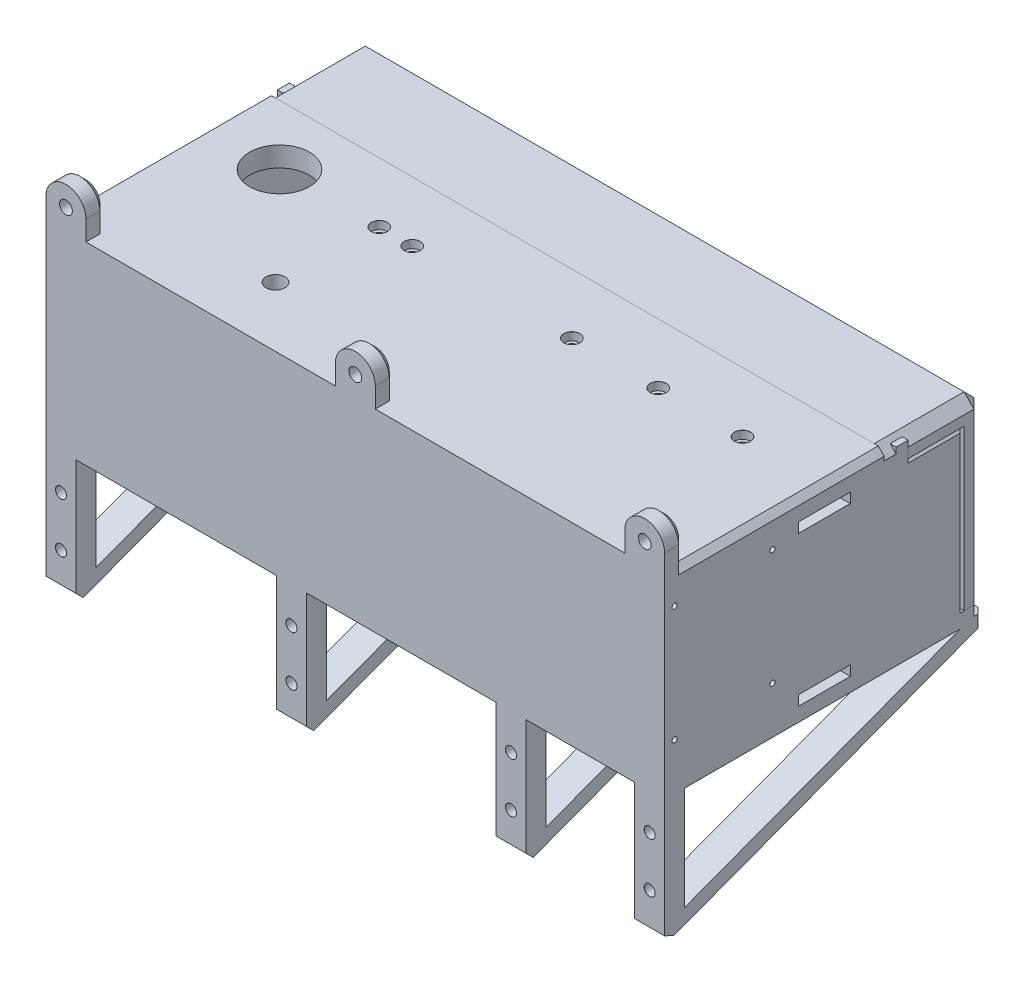
from build123d import *
from OCP.BRepFilletAPI import BRepFilletAPI_MakeChamfer

# Parameters (mm, degrees)
WALLS_DEPTH                   = 310
LID_DEPTH                     = 310
LEG1_DEPTH                    = 15
LEG4_START                    = 310
LEG4_DEPTH                    = 15
LEG2_START                    = 123
LEG2_DEPTH                    = 7.5
LEG3_START                    = 233
LEG3_DEPTH                    = 7.5
LEFTSIDESKETCH_10_W           = 140
LEFTSIDESKETCH_10_H           = 80
LEFTSIDESKETCH_10_R           = 1.2
LEFTSIDESKETCH_10_W_2         = 11
LEFTSIDESKETCH_10_H_2         = 5
RIGHT_WALL_DEPTH              = 10
LEFT_START                    = 310
LEFT_WALL_DEPTH               = 10
TABLESKETCH_W                 = 62.5
TABLESKETCH_H                 = 65
MOTOR_HOLDER_DEPTH            = 30.5
MOTOR_HOLDER2_DEPTH           = 20.5
TABLESKETCH_7_R               = 27.5
TABLESKETCH_7_R_2             = 19.2
BEARING_CUT_DEPTH             = 1.74
TABLESKETCH_14_R              = 19.2
CAROUSEL_HOLE_DEPTH           = 10
BOSS_EXTRUDE10_START          = -25
TABLESKETCH_8_R               = 3
BOSS_EXTRUDE10_DEPTH          = 15
FUNNEL_START                  = -27
TABLESKETCH_9_R               = 30.5
TABLESKETCH_9_R_2             = 24.5
FUNNEL_TOP_DEPTH              = 2
SKETCH5_W                     = 27
SKETCH5_H                     = 30
SKETCH5_W_2                   = 66
SKETCH5_H_2                   = 58
SPEC_MOUTING_DEPTH            = 4
CBORE_FOR_M4_SHCS1_AT_2_COUNT = 2
CBORE_FOR_M4_SHCS1_AT_2_PITCH = 165.5
CBORE_FOR_M4_SHCS1_AT_3_COUNT = 2
CBORE_FOR_M4_SHCS1_AT_3_PITCH = 123.25
CBORE_FOR_M4_SHCS1_AT_4_COUNT = 2
CBORE_FOR_M4_SHCS1_AT_4_PITCH = 80
CBORE_FOR_M4_SHCS1_AT_5_COUNT = 2
CBORE_FOR_M4_SHCS1_AT_5_PITCH = 16.5
M5_CLEARANCE_HOLE1_AT_2_COUNT = 2
M5_CLEARANCE_HOLE1_AT_2_PITCH = 25
M5_CLEARANCE_HOLE1_AT_3_COUNT = 2
M5_CLEARANCE_HOLE1_AT_3_PITCH = 115.5
M5_CLEARANCE_HOLE1_AT_4_COUNT = 2
M5_CLEARANCE_HOLE1_AT_4_PITCH = 118.174658874
M5_CLEARANCE_HOLE1_AT_5_COUNT = 2
M5_CLEARANCE_HOLE1_AT_5_PITCH = 225.5
M5_CLEARANCE_HOLE1_AT_6_COUNT = 2
M5_CLEARANCE_HOLE1_AT_6_PITCH = 226.88157704
M5_CLEARANCE_HOLE1_AT_7_COUNT = 2
M5_CLEARANCE_HOLE1_AT_7_PITCH = 295
M5_CLEARANCE_HOLE1_AT_8_COUNT = 2
M5_CLEARANCE_HOLE1_AT_8_PITCH = 296.057426862
SKETCH20_R                    = 4.7625
SKETCH20_R_2                  = 15
WATER_WIRE_HOLE_DEPTH         = 10
SKETCH23_R                    = 3.2
TOP_LIPS_DEPTH                = 10
LPATTERN1_COUNT               = 3
LPATTERN1_PITCH               = 145
CHAMFER1_SIZE                 = 3
CHAMFER2_SIZE                 = 5
CHAMFER2_SIZE2                = 3.883638066
SKETCH24_R                    = 1.3
RASPBERRY_PI_HOLES_DEPTH      = 10
CHAMFER4_SIZE                 = 2


# Read off the part's stored shape, not the designer's step: Join1
with BuildPart() as part:
    # LeftSideSketch → walls (new body)
    with BuildSketch(Plane(origin=(0, 0, 0), x_dir=(0, 0, -1), z_dir=(1, 0, 0))):
        Polygon((110, 0), (0, 0), (0, -100), (10, -100), (140.063991261, -100), (160, -100), (160, -95), (155, -95), (155, -90), (150, -90), (93, -90), (67, -90), (10, -90), (10, -10), (67, -10), (93, -10), (122, -10), (122, -2), (116, -2), (116, -5), (110, -5), align=None)
    extrude(amount=WALLS_DEPTH)

    # LeftSideSketch<4> → leg1 (add)
    with BuildSketch(Plane(origin=(0, 0, 0), x_dir=(0, 0, -1), z_dir=(1, 0, 0))):
        Polygon((10, -100), (0, -100), (0, -160), (160, -100), (140.063991261, -100), (10, -148.773996723), align=None)
    extrude(amount=LEG1_DEPTH)

    # LeftSideSketch<5> → leg4 (add)
    with BuildSketch(Plane(origin=(0, 0, 0), x_dir=(0, 0, -1), z_dir=(1, 0, 0)).offset(LEG4_START)):
        Polygon((10, -100), (0, -100), (0, -160), (160, -100), (140.063991261, -100), (10, -148.773996723), align=None)
    extrude(amount=-LEG4_DEPTH)

    # LeftSideSketch<7> → leg2 (add, symmetric)
    with BuildSketch(Plane(origin=(0, 0, 0), x_dir=(0, 0, -1), z_dir=(1, 0, 0)).offset(LEG2_START)):
        Polygon((140.063991261, -100), (160, -100), (0, -160), (0, -100), (10, -100), (10, -148.773996723), align=None)
    extrude(amount=LEG2_DEPTH, both=True)

    # LeftSideSketch<9> → leg3 (add, symmetric)
    with BuildSketch(Plane(origin=(0, 0, 0), x_dir=(0, 0, -1), z_dir=(1, 0, 0)).offset(LEG3_START)):
        Polygon((140.063991261, -100), (160, -100), (0, -160), (0, -100), (10, -100), (10, -148.773996723), align=None)
    extrude(amount=LEG3_DEPTH, both=True)

    # LeftSideSketch<10> → right wall (add)
    with BuildSketch(Plane(origin=(0, 0, 0), x_dir=(0, 0, -1), z_dir=(1, 0, 0))):
        with Locations((80, -50)):
            Rectangle(LEFTSIDESKETCH_10_W, LEFTSIDESKETCH_10_H)
        with Locations((15, -43)):
            Circle(LEFTSIDESKETCH_10_R, mode=Mode.SUBTRACT)
        with Locations((43, -43)):
            Circle(LEFTSIDESKETCH_10_R, mode=Mode.SUBTRACT)
        with Locations((15, -15)):
            Circle(LEFTSIDESKETCH_10_R, mode=Mode.SUBTRACT)
        with Locations((33.5, -15.7)):
            Rectangle(LEFTSIDESKETCH_10_W_2, LEFTSIDESKETCH_10_H_2, mode=Mode.SUBTRACT)
        with Locations((43, -15)):
            Circle(LEFTSIDESKETCH_10_R, mode=Mode.SUBTRACT)
    extrude(amount=RIGHT_WALL_DEPTH)

    # LeftSideSketch<11> → left wall (add)
    with BuildSketch(Plane(origin=(0, 0, 0), x_dir=(0, 0, -1), z_dir=(1, 0, 0)).offset(LEFT_START)):
        Polygon((93, -90), (150, -90), (150, -10), (93, -10), (93, -15), (67, -15), (67, -10), (10, -10), (10, -90), (67, -90), (67, -85), (93, -85), align=None)
    extrude(amount=-LEFT_WALL_DEPTH)

    # TableSketch → motor holder (add)
    with BuildSketch(Plane(origin=(0, -90, 0), x_dir=(1, 0, 0), z_dir=(0, 1, 0))):
        with Locations((173.75, 80)):
            Rectangle(TABLESKETCH_W, TABLESKETCH_H)
    extrude(amount=-MOTOR_HOLDER_DEPTH)

    # TableSketch<5> → motor holder2 (cut)
    with BuildSketch(Plane(origin=(0, -90, 0), x_dir=(1, 0, 0), z_dir=(0, 1, 0))):
        Polygon((164.75, 58.75), (164.75, 47.5), (182.75, 47.5), (182.75, 58.75), (195, 58.75), (195, 101.25), (152.5, 101.25), (152.5, 58.75), align=None)
    extrude(amount=-MOTOR_HOLDER2_DEPTH, mode=Mode.SUBTRACT)

    # TableSketch<7> → bearing cut (cut)
    with BuildSketch(Plane(origin=(0, -90, 0), x_dir=(1, 0, 0), z_dir=(0, 1, 0))):
        with Locations(Location((83.75, 80, 0), (0, 0, 270))):
            Circle(TABLESKETCH_7_R)
        with Locations(Location((83.75, 80, 0), (0, 0, 270))):
            Circle(TABLESKETCH_7_R_2, mode=Mode.SUBTRACT)
    extrude(amount=-BEARING_CUT_DEPTH, mode=Mode.SUBTRACT)

    # TableSketch<14> → carousel hole (cut)
    with BuildSketch(Plane(origin=(0, -90, 0), x_dir=(1, 0, 0), z_dir=(0, 1, 0))):
        with Locations(Location((83.75, 80, 0), (0, 0, 270))):
            Circle(TABLESKETCH_14_R)
    extrude(amount=-CAROUSEL_HOLE_DEPTH, mode=Mode.SUBTRACT)

    # TableSketch<8> → Boss-Extrude10 (add)
    with BuildSketch(Plane(origin=(0, -90, 0), x_dir=(1, 0, 0), z_dir=(0, 1, 0)).offset(BOSS_EXTRUDE10_START)):
        with BuildLine():
            ThreePointArc((113.825316241, 74.927983338), (107.887557453, 75.298262497), (113.53017636, 73.41280819))
            ThreePointArc((113.53017636, 73.41280819), (113.687333508, 74.168528279), (113.825316241, 74.927983338))
        make_face()
        with BuildLine():
            ThreePointArc((103.868845291, 57.076604437), (99.426531835, 60.997909193), (102.432131068, 55.891329801))
            ThreePointArc((102.432131068, 55.891329801), (103.159537877, 56.472997653), (103.868845291, 57.076604437))
        make_face()
        with Locations(Location((83.75, 52.5, 0), (0, 0, 270))):
            Circle(TABLESKETCH_8_R)
        with BuildLine():
            ThreePointArc((68.954160573, 60.472247041), (68.064460971, 61.179429728), (67.208514943, 61.927112236))
            ThreePointArc((67.208514943, 61.927112236), (64.383063731, 56.762240411), (68.954160573, 60.472247041))
        make_face()
        with BuildLine():
            ThreePointArc((59.946527251, 74.199596127), (59.622210051, 75.745619647), (59.398197345, 77.309329556))
            ThreePointArc((59.398197345, 77.309329556), (54.20576741, 74.79055467), (59.946527251, 74.199596127))
        make_face()
    extrude(amount=BOSS_EXTRUDE10_DEPTH)

    # TableSketch<9> → funnel top (add)
    with BuildSketch(Plane(origin=(0, -90, 0), x_dir=(1, 0, 0), z_dir=(0, 1, 0)).offset(FUNNEL_START)):
        with Locations(Location((83.75, 80, 0), (0, 0, 270))):
            Circle(TABLESKETCH_9_R)
        with Locations(Location((83.75, 80, 0), (0, 0, 270))):
            Circle(TABLESKETCH_9_R_2, mode=Mode.SUBTRACT)
    extrude(amount=FUNNEL_TOP_DEPTH)

    # Sketch6 → Revolve1 (revolve)
    with BuildSketch(Plane.XY.offset(-80), mode=Mode.PRIVATE) as revolve1_sk:
        Polygon((53.25, -117), (59.25, -117), (59.25, -118.5), (82.06, -138.072156326), (80.782338106, -141.117042041), (53.25, -118.5), align=None)
    revolve(revolve1_sk.sketch.rotate(Axis((83.75, -1117, -80), (0, 1, 0)), 90), axis=Axis((83.75, -1117, -80), (0, 1, 0)))

    # Sketch5 → spec mouting (cut)
    with BuildSketch(Plane.XZ.offset(10)):
        with Locations((183.5, -80)):
            Rectangle(SKETCH5_W, SKETCH5_H)
        with Locations((226.75, -80)):
            Rectangle(SKETCH5_W, SKETCH5_H)
        with Locations((269, -80)):
            Rectangle(SKETCH5_W, SKETCH5_H)
        with Locations((87, -80)):
            Rectangle(SKETCH5_W_2, SKETCH5_H_2)
    extrude(amount=-SPEC_MOUTING_DEPTH, mode=Mode.SUBTRACT)

    # Sketch14 → CBORE for M4 SHCS1 (revolve, cut)
    with BuildSketch(Plane(origin=(103.5, 0, -80), x_dir=(0, 0, 1), z_dir=(1, 0, 0))):
        Polygon((0, 0), (0, 11.442065486), (2.4, 10), (2.4, 4), (4, 4), (4, 0.025), (4.025, 0), align=None)
    cbore_for_m4_shcs1 = revolve(axis=Axis((103.5, 6.35, -80), (0, -1, 0)), mode=Mode.SUBTRACT)

    # CBORE for M4 SHCS1 at 2: CBORE for M4 SHCS1 ×2
    with Locations(*[(i * CBORE_FOR_M4_SHCS1_AT_2_PITCH, 0, 0) for i in range(1, CBORE_FOR_M4_SHCS1_AT_2_COUNT)]):
        add(cbore_for_m4_shcs1, mode=Mode.SUBTRACT)

    # CBORE for M4 SHCS1 at 3: CBORE for M4 SHCS1 ×2
    with Locations(*[(i * CBORE_FOR_M4_SHCS1_AT_3_PITCH, 0, 0) for i in range(1, CBORE_FOR_M4_SHCS1_AT_3_COUNT)]):
        add(cbore_for_m4_shcs1, mode=Mode.SUBTRACT)

    # CBORE for M4 SHCS1 at 4: CBORE for M4 SHCS1 ×2
    with Locations(*[(i * CBORE_FOR_M4_SHCS1_AT_4_PITCH, 0, 0) for i in range(1, CBORE_FOR_M4_SHCS1_AT_4_COUNT)]):
        add(cbore_for_m4_shcs1, mode=Mode.SUBTRACT)

    # CBORE for M4 SHCS1 at 5: CBORE for M4 SHCS1 ×2
    with Locations(*[(-i * CBORE_FOR_M4_SHCS1_AT_5_PITCH, 0, 0) for i in range(1, CBORE_FOR_M4_SHCS1_AT_5_COUNT)]):
        add(cbore_for_m4_shcs1, mode=Mode.SUBTRACT)

    # Sketch17 → M5 Clearance Hole1 (revolve, cut)
    with BuildSketch(Plane(origin=(7.5, -140, 0), x_dir=(0, -1, 0), z_dir=(1, 0, 0))):
        Polygon((0, 0), (0, 11.652366702), (2.75, 10), (2.75, 0.025), (2.775, 0), align=None)
    m5_clearance_hole1 = revolve(axis=Axis((7.5, -140, 6.35), (0, 0, -1)), mode=Mode.SUBTRACT)

    # M5 Clearance Hole1 at 2: M5 Clearance Hole1 ×2
    with Locations(*[(0, i * M5_CLEARANCE_HOLE1_AT_2_PITCH, 0) for i in range(1, M5_CLEARANCE_HOLE1_AT_2_COUNT)]):
        add(m5_clearance_hole1, mode=Mode.SUBTRACT)

    # M5 Clearance Hole1 at 3: M5 Clearance Hole1 ×2
    with Locations(*[(i * M5_CLEARANCE_HOLE1_AT_3_PITCH, 0, 0) for i in range(1, M5_CLEARANCE_HOLE1_AT_3_COUNT)]):
        add(m5_clearance_hole1, mode=Mode.SUBTRACT)

    # M5 Clearance Hole1 at 4: M5 Clearance Hole1 ×2
    with Locations(*[Vector(0.9773668999805739, 0.21155127705207255, 0) * (i * M5_CLEARANCE_HOLE1_AT_4_PITCH) for i in range(1, M5_CLEARANCE_HOLE1_AT_4_COUNT)]):
        add(m5_clearance_hole1, mode=Mode.SUBTRACT)

    # M5 Clearance Hole1 at 5: M5 Clearance Hole1 ×2
    with Locations(*[(i * M5_CLEARANCE_HOLE1_AT_5_PITCH, 0, 0) for i in range(1, M5_CLEARANCE_HOLE1_AT_5_COUNT)]):
        add(m5_clearance_hole1, mode=Mode.SUBTRACT)

    # M5 Clearance Hole1 at 6: M5 Clearance Hole1 ×2
    with Locations(*[Vector(0.9939105807634107, 0.11018964310015653, 0) * (i * M5_CLEARANCE_HOLE1_AT_6_PITCH) for i in range(1, M5_CLEARANCE_HOLE1_AT_6_COUNT)]):
        add(m5_clearance_hole1, mode=Mode.SUBTRACT)

    # M5 Clearance Hole1 at 7: M5 Clearance Hole1 ×2
    with Locations(*[(i * M5_CLEARANCE_HOLE1_AT_7_PITCH, 0, 0) for i in range(1, M5_CLEARANCE_HOLE1_AT_7_COUNT)]):
        add(m5_clearance_hole1, mode=Mode.SUBTRACT)

    # M5 Clearance Hole1 at 8: M5 Clearance Hole1 ×2
    with Locations(*[Vector(0.9964283048969312, 0.0844430766861807, 0) * (i * M5_CLEARANCE_HOLE1_AT_8_PITCH) for i in range(1, M5_CLEARANCE_HOLE1_AT_8_COUNT)]):
        add(m5_clearance_hole1, mode=Mode.SUBTRACT)

    # Join1 outline → Join1 (revolve)
    with BuildSketch(Plane(origin=(83.75, 0, -80), x_dir=(1, 0, 0), z_dir=(0, 0, 1))):
        with BuildLine():
            Line((1.685925, -138.5), (1.685925, -161.503938887))
            Line((1.685925, -161.503938887), (2.69255662, -161.503938887))
            ThreePointArc((2.69255662, -161.503938887), (2.778732934, -161.470226843), (2.819158388, -161.38698838))
            Line((2.819158388, -161.38698838), (3.171192413, -156.95212496))
            ThreePointArc((3.171192413, -156.95212496), (3.159532579, -156.918445927), (3.126881794, -156.904157637))
            Line((3.126881794, -156.904157637), (2.857993206, -156.904157637))
            ThreePointArc((2.857993206, -156.904157637), (2.825342421, -156.889869347), (2.813682587, -156.856190314))
            Line((2.813682587, -156.856190314), (3.171192413, -152.35234371))
            ThreePointArc((3.171192413, -152.35234371), (3.159532579, -152.318664677), (3.126881794, -152.304376387))
            Line((3.126881794, -152.304376387), (2.857993206, -152.304376387))
            ThreePointArc((2.857993206, -152.304376387), (2.825342421, -152.290088097), (2.813682587, -152.256409064))
            Line((2.813682587, -152.256409064), (3.171192413, -147.75256246))
            ThreePointArc((3.171192413, -147.75256246), (3.159532579, -147.718883427), (3.126881794, -147.704595137))
            Line((3.126881794, -147.704595137), (2.857993206, -147.704595137))
            ThreePointArc((2.857993206, -147.704595137), (2.825342421, -147.690306847), (2.813682587, -147.656627814))
            Line((2.813682587, -147.656627814), (3.171192413, -143.15278121))
            ThreePointArc((3.171192413, -143.15278121), (3.159532579, -143.119102177), (3.126881794, -143.104813887))
            Line((3.126881794, -143.104813887), (2.857993206, -143.104813887))
            ThreePointArc((2.857993206, -143.104813887), (2.825342421, -143.090525597), (2.813682587, -143.056846564))
            Line((2.813682587, -143.056846564), (2.967661894, -141.117042041))
            Line((2.967661894, -141.117042041), (2.967661894, -138.5))
            Line((2.967661894, -138.5), (1.685925, -138.5))
        make_face()
    revolve(axis=Axis((83.75, 0, -80), (0, 1, 0)))

    # Sketch20 → water & wire hole (cut)
    with BuildSketch(Plane(origin=(0, 0, 0), x_dir=(1, 0, 0), z_dir=(0, 1, 0))):
        with Locations(Location((85, 30, 0), (0, 0, 270))):
            Circle(SKETCH20_R)
        with Locations(Location((37, 80, 0), (0, 0, 270))):
            Circle(SKETCH20_R_2)
    extrude(amount=-WATER_WIRE_HOLE_DEPTH, mode=Mode.SUBTRACT)

    # Sketch23 → top lips (add)
    with BuildSketch(Plane.XY):
        with BuildLine():
            Line((0, 0), (0, 10))
            ThreePointArc((0, 10), (10, 20), (20, 10))
            Line((20, 10), (20, 0))
            Line((20, 0), (0, 0))
        make_face()
        with Locations((10, 10)):
            Circle(SKETCH23_R, mode=Mode.SUBTRACT)
    top_lips = extrude(amount=-TOP_LIPS_DEPTH)

    # LPattern1: top lips ×3
    with Locations(*[(i * LPATTERN1_PITCH, 0, 0) for i in range(1, LPATTERN1_COUNT)]):
        add(top_lips)

    # Chamfer1
    chamfer1_edges = [part.edges().sort_by_distance(p)[0] for p in [
        (310, 0, -60),
        (310, 5, -10),
        (310, -97.5, -160),
        (310, -100, -75.03199563),
        (0, -100, -75.03199563),
        (65.25, -100, 0),
        (65.25, -100, -160),
        (178, -100, 0),
        (178, -100, -160),
        (267.75, -100, 0),
        (267.75, -100, -160),
        (145, 5, -10),
        (155, 20, -10),
        (165, 5, -10),
        (0, 5, -10),
        (10, 20, -10),
        (20, 5, -10),
        (290, 5, -10),
        (300, 20, -10),
        (0, 0, -60),
        (0, -97.5, -160),
    ]]
    chamfer(chamfer1_edges, length=CHAMFER1_SIZE)

    # Chamfer2: one chamfer whose edges measure the first distance from different faces: ONE call of the kernel's chamfer builder (chamfer() names one face for all edges)
    chamfer2_edges_1 = [part.edges().sort_by_distance(p)[0] for p in [
        (233, -160, 0),
        (7.5, -160, 0),
        (123, -160, 0),
    ]]
    chamfer2_side_1 = [part.faces().sort_by_distance(p)[0] for p in [
        (156.190958599, -55.172853199, 0),
    ]]
    chamfer2_edges_2 = [part.edges().sort_by_distance(p)[0] for p in [
        (173.75, -120.5, -47.5),
        (205, -120.5, -80),
        (142.5, -120.5, -80),
        (173.75, -120.5, -112.5),
    ]]
    chamfer2_edges_3 = [part.edges().sort_by_distance(p)[0] for p in [
        (302.5, -160, 0),
    ]]
    chamfer2_side_3 = [part.faces().sort_by_distance(p)[0] for p in [
        (302.487789606, -130.055651221, -79.851596744),
    ]]
    chamfer2 = BRepFilletAPI_MakeChamfer(part.part.solid().wrapped)
    for e in chamfer2_edges_1:
        chamfer2.Add(CHAMFER2_SIZE, CHAMFER2_SIZE2, e.wrapped, chamfer2_side_1[0].wrapped)  # the first distance lies on this face
    for e in chamfer2_edges_2:
        chamfer2.Add(CHAMFER2_SIZE, e.wrapped)
    for e in chamfer2_edges_3:
        chamfer2.Add(CHAMFER2_SIZE, CHAMFER2_SIZE2, e.wrapped, chamfer2_side_3[0].wrapped)  # the first distance lies on this face
    add(Compound.cast(chamfer2.Shape()), mode=Mode.REPLACE)

    # Sketch24 → raspberry pi holes (cut)
    with BuildSketch(Plane(origin=(310, 0, 0), x_dir=(0, 0, -1), z_dir=(1, 0, 0))):
        with Locations((5, -15.5)):
            Circle(SKETCH24_R)
        with Locations((54, -15.5)):
            Circle(SKETCH24_R)
        with Locations((5, -73.5)):
            Circle(SKETCH24_R)
        with Locations((54, -73.5)):
            Circle(SKETCH24_R)
    extrude(amount=-RASPBERRY_PI_HOLES_DEPTH, mode=Mode.SUBTRACT)

    # Chamfer4
    chamfer4_edges = [part.edges().sort_by_distance(p)[0] for p in [
        (0, -50, -150),
        (10, -10, -136),
        (10, -50, -150),
        (0, -10, -136),
        (300, -10, -136),
        (310, -50, -150),
        (300, -50, -150),
        (310, -10, -136),
    ]]
    chamfer(chamfer4_edges, length=CHAMFER4_SIZE)


with BuildPart() as body_2:
    # LeftSideSketch<12> → lid (new body)
    with BuildSketch(Plane(origin=(0, 0, 0), x_dir=(0, 0, -1), z_dir=(1, 0, 0))):
        Polygon((160, 0), (110, 0), (110, -5), (116, -5), (116, -2), (122, -2), (122, -10), (150, -10), (150, -90), (155, -90), (155, -95), (160, -95), align=None)
    extrude(amount=LID_DEPTH)

    # Chamfer3
    # the kernel refuses this chamfer: 5 mm, written as the material it takes off along each edge
    with BuildSketch(Plane(origin=(3.333333333, -3.333333333, -156.666666667), x_dir=(0, 0.7071067811865481, 0.7071067811865468), z_dir=(-0.5773502691896255, 0.5773502691896253, -0.5773502691896265))) as chamfer3_piece_1:
        Polygon((-3.535533906, 2.041241452), (3.535533906, 2.041241452), (0, -4.082482905), align=None)
    extrude(amount=6.350852961, mode=Mode.SUBTRACT)
    with BuildSketch(Plane(origin=(306.666666667, -3.333333333, -156.666666667), x_dir=(0, 0.7071067811865481, 0.7071067811865468), z_dir=(0.5773502691896254, 0.5773502691896254, -0.5773502691896265))) as chamfer3_piece_2:
        Polygon((-3.535533906, -2.041241452), (3.535533906, -2.041241452), (0, 4.082482905), align=None)
    extrude(amount=6.350852961, mode=Mode.SUBTRACT)
    with BuildSketch(Plane(origin=(0, -107.85841494, -160), x_dir=(0.9996219169112968, 0, -0.0274958766105877), z_dir=(0, 1, 0))) as chamfer3_piece_3:
        with BuildLine():
            Line((5.143365976, 0), (-0.282735774, -5.135588968))
            Line((-0.282735774, -5.135588968), (-0.382697966, -5.13283938))
            ThreePointArc((-0.382697966, -5.13283938), (-0.170646135, -2.566989148), (-0.099962192, 0.002749588))
            Line((-0.099962192, 0.002749588), (0.002749588, 0.099962192))
            ThreePointArc((0.002749588, 0.099962192), (2.572488324, 0.029278248), (5.146115564, 0.099962192))
            Line((5.146115564, 0.099962192), (5.143365976, 0))
        make_face()
    extrude(amount=120.71682988, mode=Mode.SUBTRACT)
    with BuildSketch(Plane(origin=(-12.85841494, 0, -160), x_dir=(0, -0.9996219169112968, -0.0274958766105877), z_dir=(1, 0, 0))) as chamfer3_piece_4:
        with BuildLine():
            Line((5.143365976, 0), (-0.282735774, -5.135588968))
            Line((-0.282735774, -5.135588968), (-0.382697966, -5.13283938))
            ThreePointArc((-0.382697966, -5.13283938), (-0.170646135, -2.566989148), (-0.099962192, 0.002749588))
            Line((-0.099962192, 0.002749588), (0.002749588, 0.099962192))
            ThreePointArc((0.002749588, 0.099962192), (2.572488324, 0.029278248), (5.146115564, 0.099962192))
            Line((5.146115564, 0.099962192), (5.143365976, 0))
        make_face()
    extrude(amount=335.71682988, mode=Mode.SUBTRACT)
    with BuildSketch(Plane(origin=(310, -107.85841494, -160), x_dir=(-0.9996219169112968, 0, -0.027495876610587815), z_dir=(0, 1, 0))) as chamfer3_piece_5:
        with BuildLine():
            Line((5.143365976, 0), (-0.282735774, 5.135588968))
            Line((-0.282735774, 5.135588968), (-0.382697966, 5.13283938))
            ThreePointArc((-0.382697966, 5.13283938), (-0.170646135, 2.566989148), (-0.099962192, -0.002749588))
            Line((-0.099962192, -0.002749588), (0.002749588, -0.099962192))
            ThreePointArc((0.002749588, -0.099962192), (2.572488324, -0.029278248), (5.146115564, -0.099962192))
            Line((5.146115564, -0.099962192), (5.143365976, 0))
        make_face()
    extrude(amount=120.71682988, mode=Mode.SUBTRACT)
    with BuildSketch(Plane(origin=(0, 0, -172.85841494), x_dir=(0.9996219169112968, 0.027495876610586372, 0), z_dir=(0, 0, 1))) as chamfer3_piece_6:
        with BuildLine():
            Line((5.143365976, 0), (-0.282735774, -5.135588968))
            Line((-0.282735774, -5.135588968), (-0.382697966, -5.13283938))
            ThreePointArc((-0.382697966, -5.13283938), (-0.170646135, -2.566989148), (-0.099962192, 0.002749588))
            Line((-0.099962192, 0.002749588), (0.002749588, 0.099962192))
            ThreePointArc((0.002749588, 0.099962192), (2.572488324, 0.029278248), (5.146115564, 0.099962192))
            Line((5.146115564, 0.099962192), (5.143365976, 0))
        make_face()
    extrude(amount=75.71682988, mode=Mode.SUBTRACT)
    with BuildSketch(Plane(origin=(310, 0, -172.85841494), x_dir=(-0.9996219169112968, 0.027495876610586487, 0), z_dir=(0, 0, 1))) as chamfer3_piece_7:
        with BuildLine():
            Line((5.143365976, 0), (-0.282735774, 5.135588968))
            Line((-0.282735774, 5.135588968), (-0.382697966, 5.13283938))
            ThreePointArc((-0.382697966, 5.13283938), (-0.170646135, 2.566989148), (-0.099962192, -0.002749588))
            Line((-0.099962192, -0.002749588), (0.002749588, -0.099962192))
            ThreePointArc((0.002749588, -0.099962192), (2.572488324, -0.029278248), (5.146115564, -0.099962192))
            Line((5.146115564, -0.099962192), (5.143365976, 0))
        make_face()
    extrude(amount=75.71682988, mode=Mode.SUBTRACT)


solid = Compound([part.part, body_2.part])
